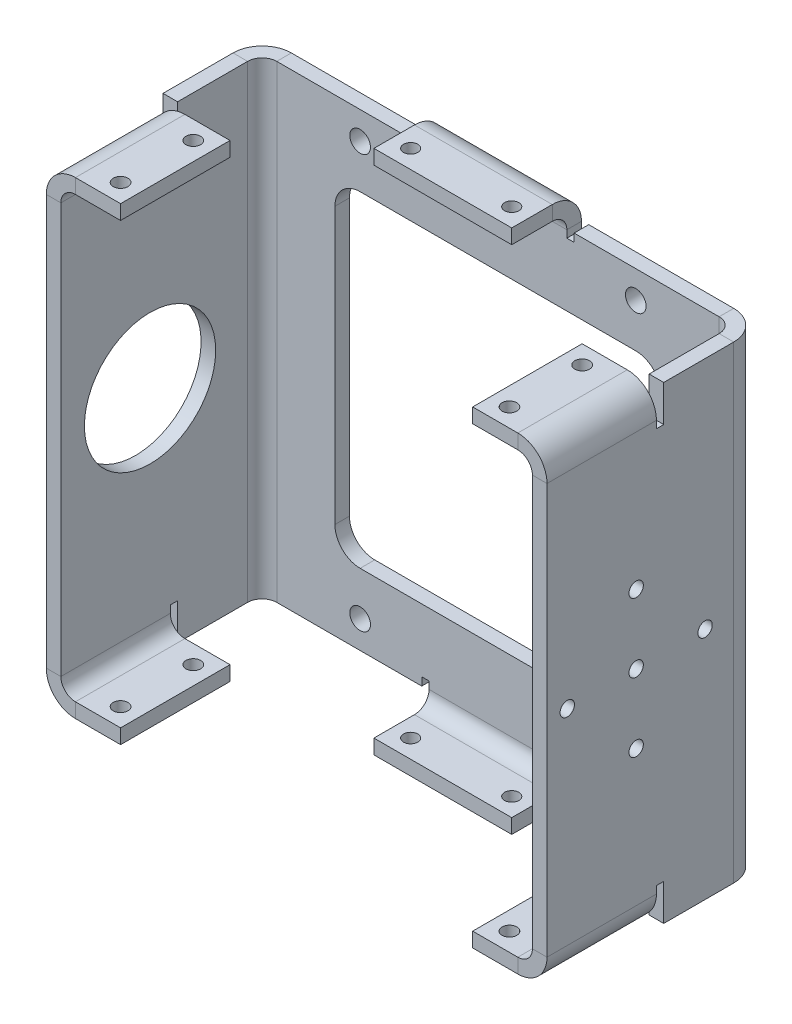
from build123d import *

# Parameters (mm, degrees)
BOSS_EXTRUDE2_DEPTH            = 51
BOSS_EXTRUDE2_DEPTH_BACK       = 51
SKETCH4_R                      = 2.25
SKETCH4_W                      = 71
SKETCH4_H                      = 71
CUT_EXTRUDE1_DEPTH             = 89.519630491
SKETCH5_R                      = 14.2875
CUT_EXTRUDE2_DEPTH             = 125.024191189
FILLET1_R                      = 5.5
CONVERT_SOLID1_START           = -20.4115
CONVERT_SOLID1_OUTLINE_W       = 109
CONVERT_SOLID1_OUTLINE_H       = 102
CONVERT_SOLID1_OUTLINE_R       = 2.25
CONVERT_SOLID1_DEPTH           = 50.4115
EDGE_FLANGE6_STRIP_W           = 19.05
EDGE_FLANGE6_STRIP_H           = 3.175
EDGE_FLANGE6_STRIP_CUT_DEPTH   = 102
EDGE_FLANGE6_STRIP_2_W         = 19.05
EDGE_FLANGE6_STRIP_2_H         = 3.175
EDGE_FLANGE6_STRIP_CUT_2_DEPTH = 102
EDGE_FLANGE6_DEPTH             = 102
EDGE_FLANGE6_BEND_DEPTH        = 102
EDGE_FLANGE8_STRIP_W           = 19.05
EDGE_FLANGE8_STRIP_H           = 3.175
EDGE_FLANGE8_STRIP_CUT_DEPTH   = 23.825
EDGE_FLANGE8_RELIEF_W          = 20.6375
EDGE_FLANGE8_RELIEF_H          = 1.5875
EDGE_FLANGE8_RELIEF_CUT_DEPTH  = 3.175
EDGE_FLANGE8_DEPTH             = 23.825
EDGE_FLANGE8_PROFILE_W         = 23.825
EDGE_FLANGE8_PROFILE_H         = 9.825
EDGE_FLANGE8_PROFILE_R         = 1.6
EDGE_FLANGE8_FLAT_DEPTH        = 3.175
MIRROR2_COPY_1_SKETCH_W        = 19.05
MIRROR2_COPY_1_SKETCH_H        = 3.175
MIRROR2_COPY_1_DEPTH           = 23.825
MIRROR2_COPY_2_SKETCH_W        = 20.6375
MIRROR2_COPY_2_SKETCH_H        = 1.5875
MIRROR2_COPY_2_DEPTH           = 3.175
MIRROR2_COPY_3_DEPTH           = 23.825
MIRROR2_COPY_4_SKETCH_W        = 23.825
MIRROR2_COPY_4_SKETCH_H        = 9.825
MIRROR2_COPY_4_SKETCH_R        = 1.6
MIRROR2_COPY_4_DEPTH           = 3.175
EDGE_FLANGE10_STRIP_W          = 22.05
EDGE_FLANGE10_STRIP_H          = 3.175
EDGE_FLANGE10_STRIP_CUT_DEPTH  = 30
EDGE_FLANGE10_RELIEF_W         = 23.6375
EDGE_FLANGE10_RELIEF_H         = 1.5875
EDGE_FLANGE10_RELIEF_CUT_DEPTH = 3.175
EDGE_FLANGE10_DEPTH            = 30
EDGE_FLANGE10_START            = 3.175
EDGE_FLANGE10_PROFILE_W        = 30
EDGE_FLANGE10_PROFILE_H        = 8.825
EDGE_FLANGE10_PROFILE_R        = 1.550163604
EDGE_FLANGE10_FLAT_DEPTH       = 3.175
CUT_EXTRUDE3_REACH             = 127.325
SKETCH31_R                     = 1.5635
CUT_EXTRUDE4_REACH             = 127.325
SKETCH57_R                     = 14.2875


# Read off the part's stored shape, not the designer's step: Convert-Solid1
# Sheet-metal steps are written as plain solids
with BuildPart() as part:
    # Sketch3 → Boss-Extrude2 (new, two sides: drawn at the far end of the back side and taken through both)
    with BuildSketch(Plane(origin=(0, 0, 0), x_dir=(1, 0, 0), z_dir=(0, 1, 0)).offset(-BOSS_EXTRUDE2_DEPTH_BACK)):
        Polygon((-48.5, -30), (-54.5, -30), (-54.5, 23.5865), (54.5, 23.5865), (54.5, -30), (48.5, -30), (48.5, 17.5865), (-48.5, 17.5865), align=None)
    extrude(amount=BOSS_EXTRUDE2_DEPTH + BOSS_EXTRUDE2_DEPTH_BACK)

    # Sketch4 → Cut-Extrude1 (cut, through all)
    with BuildSketch(Plane.XY.offset(-17.5865)):
        with Locations((-30, 45)):
            Circle(SKETCH4_R)
        with Locations((30, 45)):
            Circle(SKETCH4_R)
        with Locations((30, -45)):
            Circle(SKETCH4_R)
        with Locations((-30, -45)):
            Circle(SKETCH4_R)
        Rectangle(SKETCH4_W, SKETCH4_H)
    extrude(amount=-CUT_EXTRUDE1_DEPTH, mode=Mode.SUBTRACT)

    # Sketch5 → Cut-Extrude2 (cut, through all)
    with BuildSketch(Plane(origin=(54.5, 0, 0), x_dir=(0, 0, -1), z_dir=(1, 0, 0))):
        Circle(SKETCH5_R)
    extrude(amount=-CUT_EXTRUDE2_DEPTH, mode=Mode.SUBTRACT)

    # Fillet1
    fillet1_edges = [part.edges().sort_by_distance(p)[0] for p in [
        (-35.5, -35.5, -20.5865),
        (-35.5, 35.5, -20.5865),
        (35.5, 35.5, -20.5865),
        (35.5, -35.5, -20.5865),
    ]]
    fillet(fillet1_edges, radius=FILLET1_R)

    # Convert-Solid1 outline → Convert-Solid1 (cut)
    with BuildSketch(Plane.XY.offset(CONVERT_SOLID1_START)):
        Rectangle(CONVERT_SOLID1_OUTLINE_W, CONVERT_SOLID1_OUTLINE_H)
        with Locations((-30, -45)):
            Circle(CONVERT_SOLID1_OUTLINE_R, mode=Mode.SUBTRACT)
        with Locations((30, -45)):
            Circle(CONVERT_SOLID1_OUTLINE_R, mode=Mode.SUBTRACT)
        with Locations((-30, 45)):
            Circle(CONVERT_SOLID1_OUTLINE_R, mode=Mode.SUBTRACT)
        with BuildLine():
            Line((-35.5, -30), (-35.5, 30))
            ThreePointArc((-35.5, 30), (-33.889087297, 33.889087297), (-30, 35.5))
            Line((-30, 35.5), (30, 35.5))
            ThreePointArc((30, 35.5), (33.889087297, 33.889087297), (35.5, 30))
            Line((35.5, 30), (35.5, -30))
            ThreePointArc((35.5, -30), (33.889087297, -33.889087297), (30, -35.5))
            Line((30, -35.5), (-30, -35.5))
            ThreePointArc((-30, -35.5), (-33.889087297, -33.889087297), (-35.5, -30))
        make_face(mode=Mode.SUBTRACT)
        with Locations((30, 45)):
            Circle(CONVERT_SOLID1_OUTLINE_R, mode=Mode.SUBTRACT)
    extrude(amount=CONVERT_SOLID1_DEPTH, mode=Mode.SUBTRACT)

    # Edge-Flange6 strip (across the edge) → Edge-Flange6 strip cut (cut)
    with BuildSketch(Plane(origin=(-54.5, 51, -20.4115), x_dir=(1, 0, 0), z_dir=(0, -1, 0))):
        with Locations((-3.175, -1.5875)):
            Rectangle(EDGE_FLANGE6_STRIP_W, EDGE_FLANGE6_STRIP_H)
    extrude(amount=EDGE_FLANGE6_STRIP_CUT_DEPTH, mode=Mode.SUBTRACT)

    # Edge-Flange6 strip 2 (across the edge) → Edge-Flange6 strip cut 2 (cut)
    with BuildSketch(Plane(origin=(54.5, -51, -20.4115), x_dir=(-1, 0, 0), z_dir=(0, 1, 0))):
        with Locations((-3.175, -1.5875)):
            Rectangle(EDGE_FLANGE6_STRIP_2_W, EDGE_FLANGE6_STRIP_2_H)
    extrude(amount=EDGE_FLANGE6_STRIP_CUT_2_DEPTH, mode=Mode.SUBTRACT)

    # Edge-Flange6 section (across the edge) → Edge-Flange6 (add)
    with BuildSketch(Plane(origin=(-54.5, 51, -20.4115), x_dir=(1, 0, 0), z_dir=(0, -1, 0))):
        with BuildLine():
            Line((0, 3.175), (0, 43.825))
            Line((0, 43.825), (3.175, 43.825))
            Line((3.175, 43.825), (3.175, 3.175))
            ThreePointArc((3.175, 3.175), (4.10493597, 0.92993597), (6.35, 0))
            Line((6.35, 0), (6.35, -3.175))
            ThreePointArc((6.35, -3.175), (1.859871939, -1.315128061), (0, 3.175))
        make_face()
    extrude(amount=EDGE_FLANGE6_DEPTH)

    # Edge-Flange6 section 2 (across the edge) → Edge-Flange6 bend (add)
    with BuildSketch(Plane(origin=(54.5, -51, -20.4115), x_dir=(-1, 0, 0), z_dir=(0, 1, 0))):
        with BuildLine():
            Line((0, 3.175), (0, 43.825))
            Line((0, 43.825), (3.175, 43.825))
            Line((3.175, 43.825), (3.175, 3.175))
            ThreePointArc((3.175, 3.175), (4.10493597, 0.92993597), (6.35, 0))
            Line((6.35, 0), (6.35, -3.175))
            ThreePointArc((6.35, -3.175), (1.859871939, -1.315128061), (0, 3.175))
        make_face()
    extrude(amount=EDGE_FLANGE6_BEND_DEPTH)

    # Edge-Flange8 strip (across the edge) → Edge-Flange8 strip cut (cut)
    with BuildSketch(Plane(origin=(-51.325, 51, -0.4115), x_dir=(0, -1, 0), z_dir=(0, 0, 1))):
        with Locations((-3.175, -1.5875)):
            Rectangle(EDGE_FLANGE8_STRIP_W, EDGE_FLANGE8_STRIP_H)
    edge_flange8_strip_cut = extrude(amount=EDGE_FLANGE8_STRIP_CUT_DEPTH, mode=Mode.SUBTRACT)

    # Edge-Flange8 relief (on the sheet) → Edge-Flange8 relief cut (cut)
    with BuildSketch(Plane(origin=(-51.325, 44.65, -0.4115), x_dir=(0, -1, 0), z_dir=(1, 0, 0))):
        with Locations((-8.73125, 0.79375)):
            Rectangle(EDGE_FLANGE8_RELIEF_W, EDGE_FLANGE8_RELIEF_H)
    edge_flange8_relief_cut = extrude(amount=-EDGE_FLANGE8_RELIEF_CUT_DEPTH, mode=Mode.SUBTRACT)

    # Edge-Flange8 bend section (across the edge) → Edge-Flange8 (add)
    with BuildSketch(Plane(origin=(-51.325, 51, -0.4115), x_dir=(0, -1, 0), z_dir=(0, 0, 1))):
        with BuildLine():
            Line((0, 3.175), (3.175, 3.175))
            ThreePointArc((3.175, 3.175), (4.10493597, 0.92993597), (6.35, 0))
            Line((6.35, 0), (6.35, -3.175))
            ThreePointArc((6.35, -3.175), (1.859871939, -1.315128061), (0, 3.175))
        make_face()
    edge_flange8 = extrude(amount=EDGE_FLANGE8_DEPTH)

    # Edge-Flange8 profile (on flange) → Edge-Flange8 flat (add)
    with BuildSketch(Plane(origin=(-51.325, 51, 0), x_dir=(0, 0, 1), z_dir=(0, 1, 0))):
        with Locations((11.501, 8.0875)):
            Rectangle(EDGE_FLANGE8_PROFILE_W, EDGE_FLANGE8_PROFILE_H)
        with Locations((19.4135, 9)):
            Circle(EDGE_FLANGE8_PROFILE_R, mode=Mode.SUBTRACT)
        with Locations((3.5885, 9)):
            Circle(EDGE_FLANGE8_PROFILE_R, mode=Mode.SUBTRACT)
    edge_flange8_flat = extrude(amount=-EDGE_FLANGE8_FLAT_DEPTH)

    # Mirror1: Edge-Flange8 strip cut, Edge-Flange8 relief cut, Edge-Flange8, Edge-Flange8 flat across plane
    add(edge_flange8_strip_cut.mirror(Plane(origin=(0, 0, 0), x_dir=(0, 0, 1), z_dir=(1, 0, 0))), mode=Mode.SUBTRACT)
    add(edge_flange8_relief_cut.mirror(Plane(origin=(0, 0, 0), x_dir=(0, 0, 1), z_dir=(1, 0, 0))), mode=Mode.SUBTRACT)
    add(edge_flange8.mirror(Plane(origin=(0, 0, 0), x_dir=(0, 0, 1), z_dir=(1, 0, 0))))
    add(edge_flange8_flat.mirror(Plane(origin=(0, 0, 0), x_dir=(0, 0, 1), z_dir=(1, 0, 0))))

    # Mirror2: Edge-Flange8 strip cut, Edge-Flange8 relief cut, Edge-Flange8, Edge-Flange8 flat across plane
    add(edge_flange8_strip_cut.mirror(Plane.ZX), mode=Mode.SUBTRACT)
    add(edge_flange8_relief_cut.mirror(Plane.ZX), mode=Mode.SUBTRACT)
    add(edge_flange8.mirror(Plane.ZX))
    add(edge_flange8_flat.mirror(Plane.ZX))

    # Mirror2 copy 1 sketch → Mirror2 copy 1 (cut)
    with BuildSketch(Plane(origin=(51.325, -51, -0.4115), x_dir=(0, 1, 0), z_dir=(0, 0, 1))):
        with Locations((-3.175, -1.5875)):
            Rectangle(MIRROR2_COPY_1_SKETCH_W, MIRROR2_COPY_1_SKETCH_H)
    extrude(amount=MIRROR2_COPY_1_DEPTH, mode=Mode.SUBTRACT)

    # Mirror2 copy 2 sketch → Mirror2 copy 2 (cut)
    with BuildSketch(Plane(origin=(51.325, -44.65, -0.4115), x_dir=(0, 1, 0), z_dir=(-1, 0, 0))):
        with Locations((-8.73125, 0.79375)):
            Rectangle(MIRROR2_COPY_2_SKETCH_W, MIRROR2_COPY_2_SKETCH_H)
    extrude(amount=-MIRROR2_COPY_2_DEPTH, mode=Mode.SUBTRACT)

    # Mirror2 copy 3 sketch → Mirror2 copy 3 (add)
    with BuildSketch(Plane(origin=(51.325, -51, -0.4115), x_dir=(0, 1, 0), z_dir=(0, 0, 1))):
        with BuildLine():
            Line((0, 3.175), (3.175, 3.175))
            ThreePointArc((3.175, 3.175), (4.10493597, 0.92993597), (6.35, 0))
            Line((6.35, 0), (6.35, -3.175))
            ThreePointArc((6.35, -3.175), (1.859871939, -1.315128061), (0, 3.175))
        make_face()
    extrude(amount=MIRROR2_COPY_3_DEPTH)

    # Mirror2 copy 4 sketch → Mirror2 copy 4 (add)
    with BuildSketch(Plane(origin=(51.325, -51, 0), x_dir=(0, 0, 1), z_dir=(0, -1, 0))):
        with Locations((11.501, 8.0875)):
            Rectangle(MIRROR2_COPY_4_SKETCH_W, MIRROR2_COPY_4_SKETCH_H)
        with Locations((19.4135, 9)):
            Circle(MIRROR2_COPY_4_SKETCH_R, mode=Mode.SUBTRACT)
        with Locations((3.5885, 9)):
            Circle(MIRROR2_COPY_4_SKETCH_R, mode=Mode.SUBTRACT)
    extrude(amount=-MIRROR2_COPY_4_DEPTH)

    # Edge-Flange10 strip (across the edge) → Edge-Flange10 strip cut (cut)
    with BuildSketch(Plane(origin=(15, 54, -20.4115), x_dir=(0, -1, 0), z_dir=(-1, 0, 0))):
        with Locations((-7.85, -1.5875)):
            Rectangle(EDGE_FLANGE10_STRIP_W, EDGE_FLANGE10_STRIP_H)
    edge_flange10_strip_cut = extrude(amount=EDGE_FLANGE10_STRIP_CUT_DEPTH, mode=Mode.SUBTRACT)

    # Edge-Flange10 relief (on the sheet) → Edge-Flange10 relief cut (cut)
    with BuildSketch(Plane(origin=(15, 50.825, -20.4115), x_dir=(0, -1, 0), z_dir=(0, 0, 1))):
        with Locations((-10.23125, 0.79375)):
            Rectangle(EDGE_FLANGE10_RELIEF_W, EDGE_FLANGE10_RELIEF_H)
        with Locations((-10.23125, -30.79375)):
            Rectangle(EDGE_FLANGE10_RELIEF_W, EDGE_FLANGE10_RELIEF_H)
    edge_flange10_relief_cut = extrude(amount=-EDGE_FLANGE10_RELIEF_CUT_DEPTH, mode=Mode.SUBTRACT)

    # Edge-Flange10 bend section (across the edge) → Edge-Flange10 (add)
    with BuildSketch(Plane(origin=(15, 54, -20.4115), x_dir=(0, -1, 0), z_dir=(-1, 0, 0))):
        with BuildLine():
            Line((-3.175, 3.175), (0, 3.175))
            ThreePointArc((0, 3.175), (0.92993597, 0.92993597), (3.175, 0))
            Line((3.175, 0), (3.175, -3.175))
            ThreePointArc((3.175, -3.175), (-1.315128061, -1.315128061), (-3.175, 3.175))
        make_face()
    edge_flange10 = extrude(amount=EDGE_FLANGE10_DEPTH)

    # Edge-Flange10 profile (on flange) → Edge-Flange10 flat (add)
    with BuildSketch(Plane(origin=(0, 54, -20.4115), x_dir=(-1, 0, 0), z_dir=(0, 1, 0)).offset(EDGE_FLANGE10_START)):
        with Locations((0, 7.5875)):
            Rectangle(EDGE_FLANGE10_PROFILE_W, EDGE_FLANGE10_PROFILE_H)
        with Locations((-11, 8)):
            Circle(EDGE_FLANGE10_PROFILE_R, mode=Mode.SUBTRACT)
        with Locations((11, 8)):
            Circle(EDGE_FLANGE10_PROFILE_R, mode=Mode.SUBTRACT)
    edge_flange10_flat = extrude(amount=-EDGE_FLANGE10_FLAT_DEPTH)

    # Mirror3: Edge-Flange10 strip cut, Edge-Flange10 relief cut, Edge-Flange10, Edge-Flange10 flat across plane
    add(edge_flange10_strip_cut.mirror(Plane.ZX), mode=Mode.SUBTRACT)
    add(edge_flange10_relief_cut.mirror(Plane.ZX), mode=Mode.SUBTRACT)
    add(edge_flange10.mirror(Plane.ZX))
    add(edge_flange10_flat.mirror(Plane.ZX))

    # Sketch31 → Cut-Extrude3 (cut, up to next)
    with BuildSketch(Plane(origin=(54.5, 0, 0), x_dir=(0, 0, -1), z_dir=(1, 0, 0)), mode=Mode.PRIVATE) as cut_extrude3_sk1:
        with Locations((-19, 0)):
            Circle(SKETCH31_R)
    cut_extrude3_tool1 = extrude(cut_extrude3_sk1.sketch, amount=-CUT_EXTRUDE3_REACH, mode=Mode.PRIVATE) & part.part
    # Sketch31 → Cut-Extrude3 (cut, up to next)
    with BuildSketch(Plane(origin=(54.5, 0, 0), x_dir=(0, 0, -1), z_dir=(1, 0, 0)), mode=Mode.PRIVATE) as cut_extrude3_sk2:
        with Locations((-4, 15)):
            Circle(SKETCH31_R)
    cut_extrude3_tool2 = extrude(cut_extrude3_sk2.sketch, amount=-CUT_EXTRUDE3_REACH, mode=Mode.PRIVATE) & part.part
    # Sketch31 → Cut-Extrude3 (cut, up to next)
    with BuildSketch(Plane(origin=(54.5, 0, 0), x_dir=(0, 0, -1), z_dir=(1, 0, 0)), mode=Mode.PRIVATE) as cut_extrude3_sk3:
        with Locations((11, 0)):
            Circle(SKETCH31_R)
    cut_extrude3_tool3 = extrude(cut_extrude3_sk3.sketch, amount=-CUT_EXTRUDE3_REACH, mode=Mode.PRIVATE) & part.part
    # Sketch31 → Cut-Extrude3 (cut, up to next)
    with BuildSketch(Plane(origin=(54.5, 0, 0), x_dir=(0, 0, -1), z_dir=(1, 0, 0)), mode=Mode.PRIVATE) as cut_extrude3_sk4:
        with Locations((-4, -15)):
            Circle(SKETCH31_R)
    cut_extrude3_tool4 = extrude(cut_extrude3_sk4.sketch, amount=-CUT_EXTRUDE3_REACH, mode=Mode.PRIVATE) & part.part
    # Sketch31 → Cut-Extrude3 (cut, up to next)
    with BuildSketch(Plane(origin=(54.5, 0, 0), x_dir=(0, 0, -1), z_dir=(1, 0, 0)), mode=Mode.PRIVATE) as cut_extrude3_sk5:
        with Locations((-4, 0)):
            Circle(SKETCH31_R)
    cut_extrude3_tool5 = extrude(cut_extrude3_sk5.sketch, amount=-CUT_EXTRUDE3_REACH, mode=Mode.PRIVATE) & part.part
    add(cut_extrude3_tool1.solids().sort_by_distance((54.5, 0, 19))[0], mode=Mode.SUBTRACT)
    add(cut_extrude3_tool2.solids().sort_by_distance((54.5, 15, 4))[0], mode=Mode.SUBTRACT)
    add(cut_extrude3_tool3.solids().sort_by_distance((54.5, 0, -11))[0], mode=Mode.SUBTRACT)
    add(cut_extrude3_tool4.solids().sort_by_distance((54.5, -15, 4))[0], mode=Mode.SUBTRACT)
    add(cut_extrude3_tool5.solids().sort_by_distance((54.5, 0, 4))[0], mode=Mode.SUBTRACT)

    # Sketch57 → Cut-Extrude4 (cut, up to next)
    with BuildSketch(Plane.ZY.offset(54.5), mode=Mode.PRIVATE) as cut_extrude4_sk1:
        with Locations((4, 0)):
            Circle(SKETCH57_R)
    cut_extrude4_tool1 = extrude(cut_extrude4_sk1.sketch, amount=-CUT_EXTRUDE4_REACH, mode=Mode.PRIVATE) & part.part
    add(cut_extrude4_tool1.solids().sort_by_distance((-54.5, 0, 4))[0], mode=Mode.SUBTRACT)


solid = part.part
